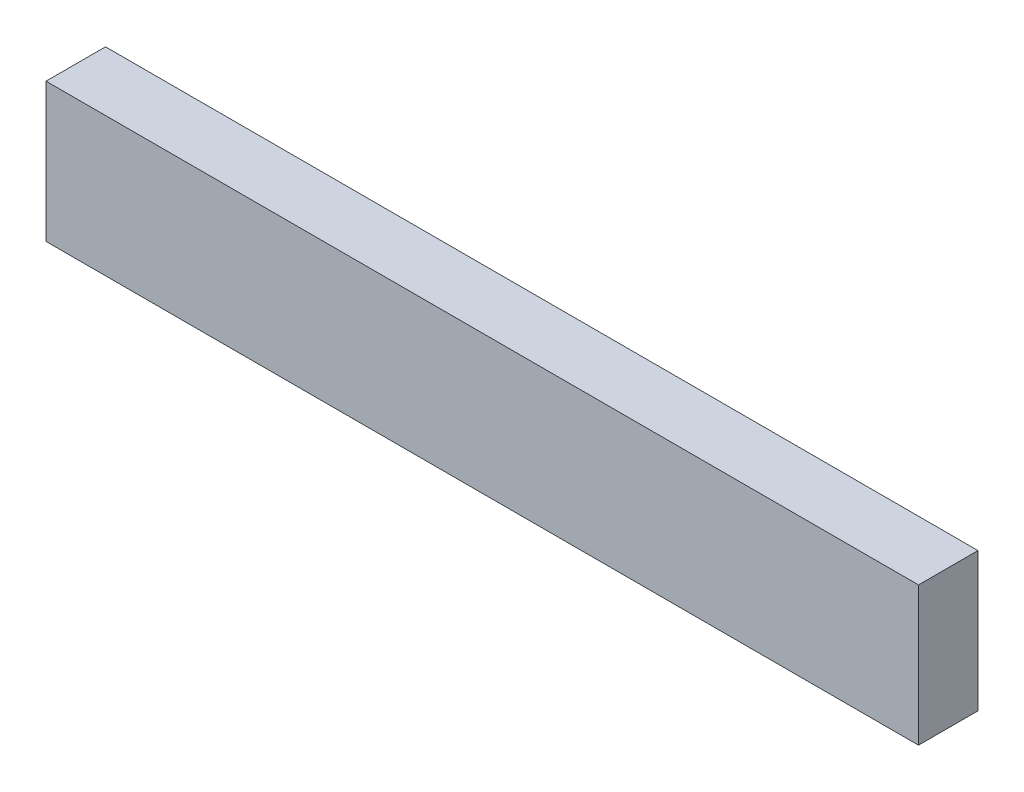
from build123d import *

# Parameters (mm, degrees)
SKETCH1_W           = 38.1
SKETCH1_H           = 88.9
BOSS_EXTRUDE1_DEPTH = 558.8


with BuildPart() as part:
    # Sketch1 → Boss-Extrude1 (new body)
    with BuildSketch(Plane(origin=(0, 0, 0), x_dir=(0, 0, -1), z_dir=(1, 0, 0))):
        Rectangle(SKETCH1_W, SKETCH1_H)
    extrude(amount=BOSS_EXTRUDE1_DEPTH)


solid = part.part
